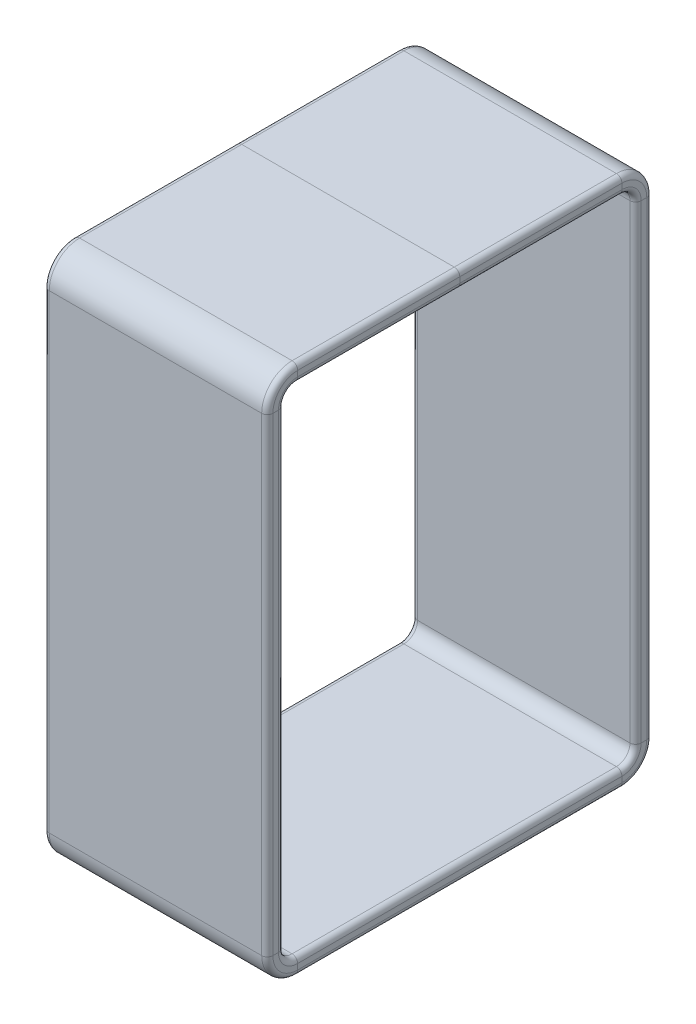
from build123d import *


with BuildPart() as part:
    # Sweep1: sweep along a path in Sketch1
    with BuildLine(Plane(origin=(0, 0, 0), x_dir=(0, 0, -1), z_dir=(1, 0, 0))) as sweep1_path:
        Line((14.5, 23), (-14.5, 23))
        ThreePointArc((-14.5, 23), (-15.914213562, 22.414213562), (-16.5, 21))
        Line((-16.5, 21), (-16.5, -21))
        ThreePointArc((-16.5, -21), (-15.914213562, -22.414213562), (-14.5, -23))
        Line((-14.5, -23), (14.5, -23))
        ThreePointArc((14.5, -23), (15.914213562, -22.414213562), (16.5, -21))
        Line((16.5, -21), (16.5, 21))
        ThreePointArc((16.5, 21), (15.914213562, 22.414213562), (14.5, 23))
    # Sketch2 → Sweep1 (sweep)
    with BuildSketch(Plane.XY):
        with BuildLine():
            Line((-9.5, 23.718775567), (9.5, 23.718775567))
            ThreePointArc((9.5, 23.718775567), (9.853553391, 23.572328958), (10, 23.218775567))
            Line((10, 23.218775567), (10, 22.718775567))
            ThreePointArc((10, 22.718775567), (9.853553391, 22.365222177), (9.5, 22.218775567))
            Line((9.5, 22.218775567), (-9.5, 22.218775567))
            ThreePointArc((-9.5, 22.218775567), (-9.853553391, 22.365222177), (-10, 22.718775567))
            Line((-10, 22.718775567), (-10, 23.218775567))
            ThreePointArc((-10, 23.218775567), (-9.853553391, 23.572328958), (-9.5, 23.718775567))
        make_face()
    sweep(path=sweep1_path.line)


solid = part.part
